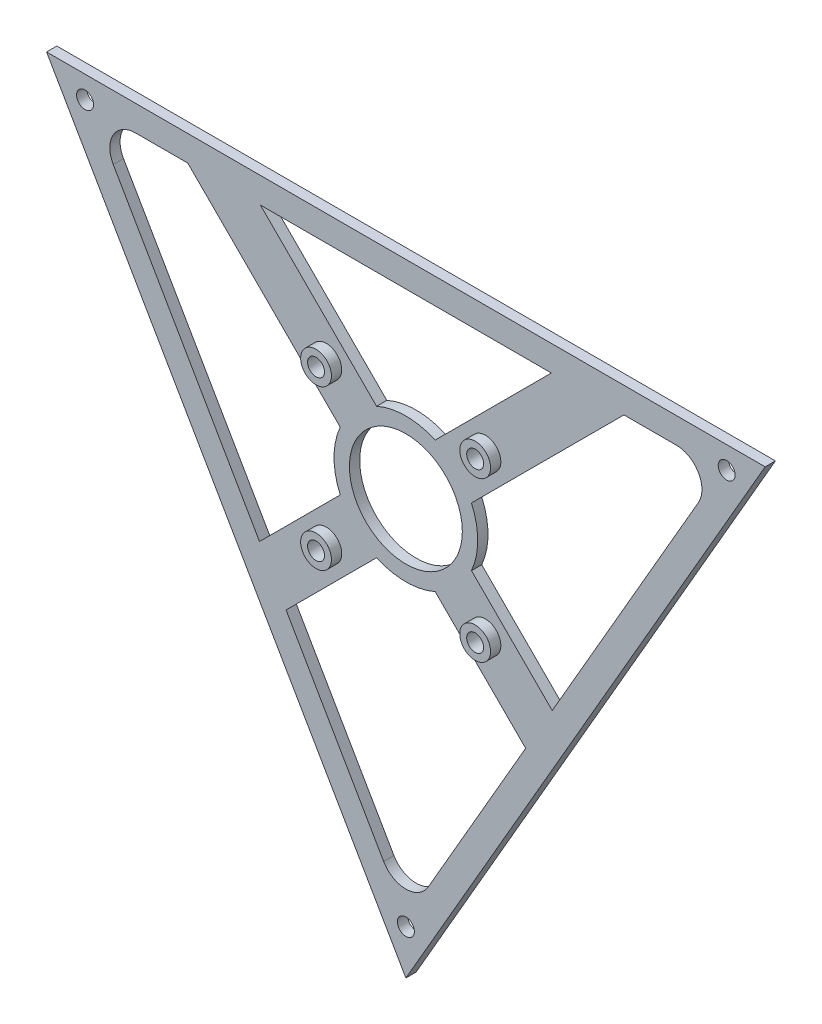
from build123d import *
from build123d.topology import SkipClean

# Parameters (mm, degrees)
SKETCH1_R               = 1.65
SKETCH1_R_2             = 11
BOSS_EXTRUDE1_DEPTH     = 2
SHELL2_T                = -1
SKETCH3_R               = 4.65
SKETCH3_R_2             = 2.65
SKETCH3_R_3             = 14
SKETCH3_R_4             = 12
BOSS_EXTRUDE2_DEPTH     = 1
SKETCH4_R               = 4.65
BOSS_EXTRUDE3_DEPTH     = 1
CUT_EXTRUDE2_DEPTH      = 107.931442211
CUT_EXTRUDE2_DEPTH_BACK = 107.931442211
FILLET2_DEPTH           = 2
SKETCH7_R               = 1.65
CUT_EXTRUDE3_DEPTH      = 107.945468971
SKETCH8_R               = 3
SKETCH8_R_2             = 1.65
BOSS_EXTRUDE4_DEPTH     = 2


with BuildPart() as part:
    # Sketch1 → Boss-Extrude1 (new body)
    with BuildSketch(Plane.XY):
        Polygon((70, 40.414518843), (-70, 40.414518843), (0, -80.829037687), align=None)
        with Locations((-15.5, -15.5)):
            Circle(SKETCH1_R, mode=Mode.SUBTRACT)
        with Locations((15.5, -15.5)):
            Circle(SKETCH1_R, mode=Mode.SUBTRACT)
        with Locations((15.5, 15.5)):
            Circle(SKETCH1_R, mode=Mode.SUBTRACT)
        with Locations((-15.5, 15.5)):
            Circle(SKETCH1_R, mode=Mode.SUBTRACT)
        Circle(SKETCH1_R_2, mode=Mode.SUBTRACT)
    extrude(amount=BOSS_EXTRUDE1_DEPTH)

    # Shell2
    shell2_openings = [part.faces().sort_by_distance(p)[0] for p in [
        (0, 38.562492926, 2),
    ]]
    offset(amount=SHELL2_T, openings=shell2_openings, kind=Kind.INTERSECTION)

    # Sketch3 → Boss-Extrude2 (add)
    # profile 1 of 6: a face of its own
    with BuildSketch(Plane.XY.offset(1)):
        Polygon((68.267949192, 39.414518843), (-68.267949192, 39.414518843), (0, -78.829037687), align=None)
        Polygon((61.339745962, 35.414518843), (-61.339745962, 35.414518843), (0, -70.829037687), align=None, mode=Mode.SUBTRACT)
    # profile 2 of 6: a face of its own
    with BuildSketch(Plane.XY.offset(1)):
        with Locations((-15.5, -15.5)):
            Circle(SKETCH3_R)
        with Locations((-15.5, -15.5)):
            Circle(SKETCH3_R_2, mode=Mode.SUBTRACT)
    # profile 3 of 6: a face of its own
    with BuildSketch(Plane.XY.offset(1)):
        with Locations((15.5, -15.5)):
            Circle(SKETCH3_R)
        with Locations((15.5, -15.5)):
            Circle(SKETCH3_R_2, mode=Mode.SUBTRACT)
    # profile 4 of 6: a face of its own
    with BuildSketch(Plane.XY.offset(1)):
        Circle(SKETCH3_R_3)
        Circle(SKETCH3_R_4, mode=Mode.SUBTRACT)
    # profile 5 of 6: a face of its own
    with BuildSketch(Plane.XY.offset(1)):
        with Locations((15.5, 15.5)):
            Circle(SKETCH3_R)
        with Locations((15.5, 15.5)):
            Circle(SKETCH3_R_2, mode=Mode.SUBTRACT)
    # profile 6 of 6: a face of its own
    with BuildSketch(Plane.XY.offset(1)):
        with Locations((-15.5, 15.5)):
            Circle(SKETCH3_R)
        with Locations((-15.5, 15.5)):
            Circle(SKETCH3_R_2, mode=Mode.SUBTRACT)
    extrude(amount=BOSS_EXTRUDE2_DEPTH)

    # Sketch4 → Boss-Extrude3 (add)
    # profile 1 of 4: a face of its own
    with BuildSketch(Plane.XY.offset(1)):
        with BuildLine():
            Line((-23.337036668, -30.40810448), (-5.711087099, -12.78215491))
            ThreePointArc((-5.711087099, -12.78215491), (-9.899494937, -9.899494937), (-12.78215491, -5.711087099))
            Line((-12.78215491, -5.711087099), (-28.51341757, -21.442349758))
            Line((-28.51341757, -21.442349758), (-23.337036668, -30.40810448))
        make_face()
        with Locations((-15.5, -15.5)):
            Circle(SKETCH4_R, mode=Mode.SUBTRACT)
    # profile 2 of 4: a face of its own
    with BuildSketch(Plane.XY.offset(1)):
        with BuildLine():
            ThreePointArc((12.78215491, -5.711087099), (9.899494937, -9.899494937), (5.711087099, -12.78215491))
            Line((5.711087099, -12.78215491), (23.337036668, -30.40810448))
            Line((23.337036668, -30.40810448), (28.51341757, -21.442349758))
            Line((28.51341757, -21.442349758), (12.78215491, -5.711087099))
        make_face()
        with Locations((15.5, -15.5)):
            Circle(SKETCH4_R, mode=Mode.SUBTRACT)
    # profile 3 of 4: a face of its own
    with BuildSketch(Plane.XY.offset(1)):
        with BuildLine():
            ThreePointArc((5.711087099, 12.78215491), (9.899494937, 9.899494937), (12.78215491, 5.711087099))
            Line((12.78215491, 5.711087099), (42.485586655, 35.414518843))
            Line((42.485586655, 35.414518843), (28.343451031, 35.414518843))
            Line((28.343451031, 35.414518843), (5.711087099, 12.78215491))
        make_face()
        with Locations((15.5, 15.5)):
            Circle(SKETCH4_R, mode=Mode.SUBTRACT)
    # profile 4 of 4: a face of its own
    with BuildSketch(Plane.XY.offset(1)):
        with BuildLine():
            Line((-42.485586655, 35.414518843), (-12.78215491, 5.711087099))
            ThreePointArc((-12.78215491, 5.711087099), (-9.899494937, 9.899494937), (-5.711087099, 12.78215491))
            Line((-5.711087099, 12.78215491), (-28.343451031, 35.414518843))
            Line((-28.343451031, 35.414518843), (-42.485586655, 35.414518843))
        make_face()
        with Locations((-15.5, 15.5)):
            Circle(SKETCH4_R, mode=Mode.SUBTRACT)
    extrude(amount=BOSS_EXTRUDE3_DEPTH)

    # Sketch6 → Cut-Extrude2 (cut, two sides: drawn at the far end of the back side and taken through both)
    with BuildSketch(Plane.XY.offset(1).offset(-CUT_EXTRUDE2_DEPTH_BACK)):
        with BuildLine():
            Line((-12.78215491, 5.711087099), (-42.485586655, 35.414518843))
            Line((-42.485586655, 35.414518843), (-61.339745962, 35.414518843))
            Line((-61.339745962, 35.414518843), (-28.51341757, -21.442349758))
            Line((-28.51341757, -21.442349758), (-12.78215491, -5.711087099))
            ThreePointArc((-12.78215491, -5.711087099), (-14, 0), (-12.78215491, 5.711087099))
        make_face()
        with BuildLine():
            Line((0, -70.829037687), (23.337036668, -30.40810448))
            Line((23.337036668, -30.40810448), (5.711087099, -12.78215491))
            ThreePointArc((5.711087099, -12.78215491), (0, -14), (-5.711087099, -12.78215491))
            Line((-5.711087099, -12.78215491), (-23.337036668, -30.40810448))
            Line((-23.337036668, -30.40810448), (0, -70.829037687))
        make_face()
        with BuildLine():
            Line((42.485586655, 35.414518843), (12.78215491, 5.711087099))
            ThreePointArc((12.78215491, 5.711087099), (14, 0), (12.78215491, -5.711087099))
            Line((12.78215491, -5.711087099), (28.51341757, -21.442349758))
            Line((28.51341757, -21.442349758), (61.339745962, 35.414518843))
            Line((61.339745962, 35.414518843), (42.485586655, 35.414518843))
        make_face()
        with BuildLine():
            Line((-28.343451031, 35.414518843), (-5.711087099, 12.78215491))
            ThreePointArc((-5.711087099, 12.78215491), (0, 14), (5.711087099, 12.78215491))
            Line((5.711087099, 12.78215491), (28.343451031, 35.414518843))
            Line((28.343451031, 35.414518843), (-28.343451031, 35.414518843))
        make_face()
    extrude(amount=CUT_EXTRUDE2_DEPTH + CUT_EXTRUDE2_DEPTH_BACK, mode=Mode.SUBTRACT)

    # Fillet2: read off the stored shape, not the designer's step
    # Fillet2 outline → Fillet2 (add)
    with SkipClean():  # the faces are left unmerged after this step: merging them gives an invalid solid
        with BuildSketch(Plane.XY):
            with BuildLine():
                ThreePointArc((4.330127019, -63.329037687), (0, -65.829037687), (-4.330127019, -63.329037687))
                Line((-4.330127019, -63.329037687), (0, -70.829037687))
                Line((0, -70.829037687), (4.330127019, -63.329037687))
            make_face()
            with BuildLine():
                ThreePointArc((52.679491924, 35.414518843), (57.009618943, 32.914518843), (57.009618943, 27.914518843))
                Line((57.009618943, 27.914518843), (61.339745962, 35.414518843))
                Line((61.339745962, 35.414518843), (52.679491924, 35.414518843))
            make_face()
            with BuildLine():
                ThreePointArc((-57.009618943, 27.914518843), (-57.009618943, 32.914518843), (-52.679491924, 35.414518843))
                Line((-52.679491924, 35.414518843), (-61.339745962, 35.414518843))
                Line((-61.339745962, 35.414518843), (-57.009618943, 27.914518843))
            make_face()
        extrude(amount=FILLET2_DEPTH)
    add(part.part.scale(1), mode=Mode.REPLACE)  # the faces are merged on a copy

    # Sketch7 → Cut-Extrude3 (cut, through all)
    with BuildSketch(Plane.XY.offset(2)):
        with Locations((-62.5, 36.084391824)):
            Circle(SKETCH7_R)
        with Locations((62.5, 36.084391824)):
            Circle(SKETCH7_R)
        with Locations((0, -72.168783649)):
            Circle(SKETCH7_R)
    extrude(amount=-CUT_EXTRUDE3_DEPTH, mode=Mode.SUBTRACT)

    # Sketch8 → Boss-Extrude4 (add)
    # profile 1 of 4: a face of its own
    with BuildSketch(Plane.XY.offset(2)):
        with Locations((-15.5, 15.5)):
            Circle(SKETCH8_R)
        with Locations((-15.5, 15.5)):
            Circle(SKETCH8_R_2, mode=Mode.SUBTRACT)
    # profile 2 of 4: a face of its own
    with BuildSketch(Plane.XY.offset(2)):
        with Locations((15.5, 15.5)):
            Circle(SKETCH8_R)
        with Locations((15.5, 15.5)):
            Circle(SKETCH8_R_2, mode=Mode.SUBTRACT)
    # profile 3 of 4: a face of its own
    with BuildSketch(Plane.XY.offset(2)):
        with Locations((15.5, -15.5)):
            Circle(SKETCH8_R)
        with Locations((15.5, -15.5)):
            Circle(SKETCH8_R_2, mode=Mode.SUBTRACT)
    # profile 4 of 4: a face of its own
    with BuildSketch(Plane.XY.offset(2)):
        with Locations((-15.5, -15.5)):
            Circle(SKETCH8_R)
        with Locations((-15.5, -15.5)):
            Circle(SKETCH8_R_2, mode=Mode.SUBTRACT)
    extrude(amount=BOSS_EXTRUDE4_DEPTH)


solid = part.part
